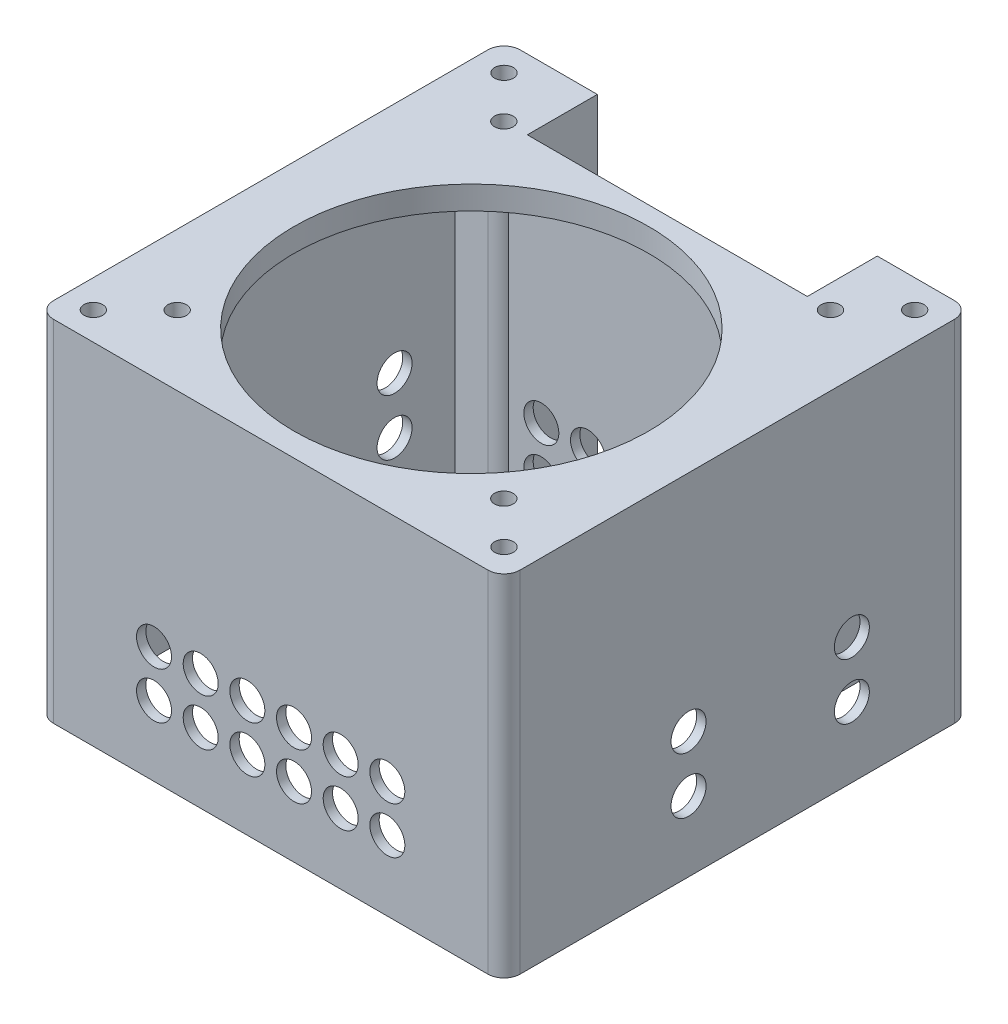
from build123d import *

# Parameters (mm, degrees)
SKETCH2_R                 = 2
BOSS_EXTRUDE1_DEPTH       = 70
BOSS_EXTRUDE2_OUTLINE_R   = 2
BOSS_EXTRUDE2_OUTLINE_R_2 = 38
BOSS_EXTRUDE2_DEPTH       = 5
SKETCH5_R                 = 3.75
CUT_EXTRUDE1_DEPTH        = 89
SKETCH6_R                 = 3.75
CUT_EXTRUDE2_DEPTH        = 101


# Read off the part's stored shape, not the designer's step: Boss-Extrude2
with BuildPart() as part:
    # Sketch2 → Boss-Extrude1 (new body)
    with BuildSketch(Plane(origin=(0, 0, 0), x_dir=(1, 0, 0), z_dir=(0, 1, 0))):
        with BuildLine():
            Line((-40.95316077, -50), (-46.54683923, -50))
            ThreePointArc((-46.54683923, -50), (-48.988592627, -48.988592627), (-50, -46.54683923))
            Line((-50, -46.54683923), (-50, -40.95316077))
            Line((-50, -40.95316077), (-50, 40.95316077))
            Line((-50, 40.95316077), (-50, 46.54683923))
            ThreePointArc((-50, 46.54683923), (-48.988592627, 48.988592627), (-46.54683923, 50))
            Line((-46.54683923, 50), (-40.95316077, 50))
            Line((-40.95316077, 50), (-30, 50))
            Line((-30, 50), (-30, 35))
            Line((-30, 35), (30, 35))
            Line((30, 35), (30, 50))
            Line((30, 50), (40.95316077, 50))
            Line((40.95316077, 50), (46.54683923, 50))
            ThreePointArc((46.54683923, 50), (48.988592627, 48.988592627), (50, 46.54683923))
            Line((50, 46.54683923), (50, 40.95316077))
            Line((50, 40.95316077), (50, -40.95316077))
            Line((50, -40.95316077), (50, -46.54683923))
            ThreePointArc((50, -46.54683923), (48.988592627, -48.988592627), (46.54683923, -50))
            Line((46.54683923, -50), (40.95316077, -50))
            Line((40.95316077, -50), (-40.95316077, -50))
        make_face()
        with Locations(Location((-44, 44, 0), (0, 0, 270))):
            Circle(SKETCH2_R, mode=Mode.SUBTRACT)
        with Locations(Location((44, 44, 0), (0, 0, 270))):
            Circle(SKETCH2_R, mode=Mode.SUBTRACT)
        with Locations(Location((44, -44, 0), (0, 0, 270))):
            Circle(SKETCH2_R, mode=Mode.SUBTRACT)
        with Locations(Location((-44, -44, 0), (0, 0, 270))):
            Circle(SKETCH2_R, mode=Mode.SUBTRACT)
        with BuildLine():
            Line((-48, -37.5), (-40.95316077, -37.5))
            ThreePointArc((-40.95316077, -37.5), (-38.511407373, -38.511407373), (-37.5, -40.95316077))
            Line((-37.5, -40.95316077), (-37.5, -48))
            Line((-37.5, -48), (37.5, -48))
            Line((37.5, -48), (37.5, -40.95316077))
            ThreePointArc((37.5, -40.95316077), (38.511407373, -38.511407373), (40.95316077, -37.5))
            Line((40.95316077, -37.5), (48, -37.5))
            Line((48, -37.5), (48, 37.5))
            Line((48, 37.5), (40.95316077, 37.5))
            ThreePointArc((40.95316077, 37.5), (38.511407373, 38.511407373), (37.5, 40.95316077))
            Line((37.5, 40.95316077), (37.5, 48))
            Line((37.5, 48), (32, 48))
            Line((32, 48), (32, 33))
            Line((32, 33), (-32, 33))
            Line((-32, 33), (-32, 48))
            Line((-32, 48), (-37.5, 48))
            Line((-37.5, 48), (-37.5, 40.95316077))
            ThreePointArc((-37.5, 40.95316077), (-38.511407373, 38.511407373), (-40.95316077, 37.5))
            Line((-40.95316077, 37.5), (-48, 37.5))
            Line((-48, 37.5), (-48, -37.5))
        make_face(mode=Mode.SUBTRACT)
    extrude(amount=BOSS_EXTRUDE1_DEPTH)

    # Boss-Extrude2 outline → Boss-Extrude2 (add)
    with BuildSketch(Plane(origin=(0, 70, 0), x_dir=(1, 0, 0), z_dir=(0, 1, 0))):
        with BuildLine():
            ThreePointArc((-46.54683923, 50), (-48.988592627, 48.988592627), (-50, 46.54683923))
            Line((-50, 46.54683923), (-50, -46.54683923))
            ThreePointArc((-50, -46.54683923), (-48.988592627, -48.988592627), (-46.54683923, -50))
            Line((-46.54683923, -50), (46.54683923, -50))
            ThreePointArc((46.54683923, -50), (48.988592627, -48.988592627), (50, -46.54683923))
            Line((50, -46.54683923), (50, 46.54683923))
            ThreePointArc((50, 46.54683923), (48.988592627, 48.988592627), (46.54683923, 50))
            Line((46.54683923, 50), (30, 50))
            Line((30, 50), (30, 35))
            Line((30, 35), (-30, 35))
            Line((-30, 35), (-30, 50))
            Line((-30, 50), (-46.54683923, 50))
        make_face()
        with Locations((-44, -44)):
            Circle(BOSS_EXTRUDE2_OUTLINE_R, mode=Mode.SUBTRACT)
        with Locations((-35, -35.037384196)):
            Circle(BOSS_EXTRUDE2_OUTLINE_R, mode=Mode.SUBTRACT)
        with Locations((44, -44)):
            Circle(BOSS_EXTRUDE2_OUTLINE_R, mode=Mode.SUBTRACT)
        with Locations((35, -35.037384196)):
            Circle(BOSS_EXTRUDE2_OUTLINE_R, mode=Mode.SUBTRACT)
        with Locations((0, -7)):
            Circle(BOSS_EXTRUDE2_OUTLINE_R_2, mode=Mode.SUBTRACT)
        with Locations((-35, 34.962615804)):
            Circle(BOSS_EXTRUDE2_OUTLINE_R, mode=Mode.SUBTRACT)
        with Locations((-44, 44)):
            Circle(BOSS_EXTRUDE2_OUTLINE_R, mode=Mode.SUBTRACT)
        with Locations((35, 34.962615804)):
            Circle(BOSS_EXTRUDE2_OUTLINE_R, mode=Mode.SUBTRACT)
        with Locations((44, 44)):
            Circle(BOSS_EXTRUDE2_OUTLINE_R, mode=Mode.SUBTRACT)
    extrude(amount=BOSS_EXTRUDE2_DEPTH)

    # Sketch5 → Cut-Extrude1 (cut)
    with BuildSketch(Plane(origin=(0, 0, -35), x_dir=(-1, 0, 0), z_dir=(0, 0, -1))):
        with Locations((-25, 15)):
            Circle(SKETCH5_R)
        with Locations((-15, 15)):
            Circle(SKETCH5_R)
        with Locations((-5, 15)):
            Circle(SKETCH5_R)
        with Locations((5, 15)):
            Circle(SKETCH5_R)
        with Locations((15, 15)):
            Circle(SKETCH5_R)
        with Locations((25, 15)):
            Circle(SKETCH5_R)
        with Locations((-25, 25)):
            Circle(SKETCH5_R)
        with Locations((-5, 25)):
            Circle(SKETCH5_R)
        with Locations((5, 25)):
            Circle(SKETCH5_R)
        with Locations((15, 25)):
            Circle(SKETCH5_R)
        with Locations((25, 25)):
            Circle(SKETCH5_R)
        with Locations((-15, 25)):
            Circle(SKETCH5_R)
    extrude(amount=-CUT_EXTRUDE1_DEPTH, mode=Mode.SUBTRACT)

    # Sketch6 → Cut-Extrude2 (cut)
    with BuildSketch(Plane.ZY.offset(50)):
        with Locations((-24.54683923, 15.00014135)):
            Circle(SKETCH6_R)
        with Locations((10.45316077, 15.000000015)):
            Circle(SKETCH6_R)
        with Locations((10.45316077, 27.000000015)):
            Circle(SKETCH6_R)
        with Locations((-24.54683923, 27.00014135)):
            Circle(SKETCH6_R)
    extrude(amount=-CUT_EXTRUDE2_DEPTH, mode=Mode.SUBTRACT)


solid = part.part
